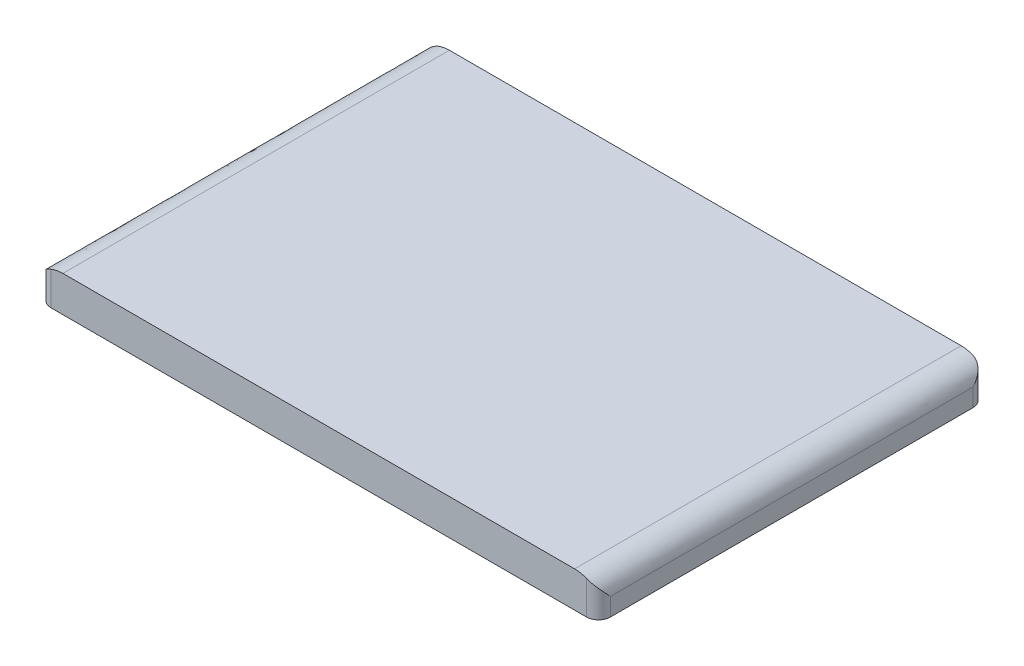
from build123d import *

# Parameters (mm, degrees)
SKETCH1_W           = 93.8
SKETCH1_H           = 32.4
BOSS_EXTRUDE1_DEPTH = 2
SKETCH3_W           = 93.8
SKETCH3_H           = 64.8
SKETCH3_W_2         = 91.4
SKETCH3_H_2         = 62.4
SKETCH3_W_3         = 86.6
SKETCH3_H_3         = 57.6
SKETCH3_W_4         = 83.8
SKETCH3_H_4         = 54.8
BOSS_EXTRUDE2_DEPTH = 4
FILLET6_R           = 2
FILLET8_START       = -66
FILLET8_DEPTH       = 67
FILLET9_R           = 2
FILLET10_R          = 2


with BuildPart() as part:
    # Sketch1 → Boss-Extrude1 (new body)
    with BuildSketch(Plane(origin=(0, 0, 0), x_dir=(1, 0, 0), z_dir=(0, 1, 0))):
        with Locations((46.9, 48.6)):
            Rectangle(SKETCH1_W, SKETCH1_H)
        Polygon((93.8, 32.4), (0, 32.4), (0, 0), (42.9, 0), (50.9, 0), (93.8, 0), align=None)
    extrude(amount=BOSS_EXTRUDE1_DEPTH)

    # Sketch3 → Boss-Extrude2 (add)
    # profile 1 of 2: a face of its own
    with BuildSketch(Plane.XZ):
        with Locations((46.9, -32.4)):
            Rectangle(SKETCH3_W, SKETCH3_H)
        with Locations((46.9, -32.4)):
            Rectangle(SKETCH3_W_2, SKETCH3_H_2, mode=Mode.SUBTRACT)
    # profile 2 of 2: a face of its own
    with BuildSketch(Plane.XZ):
        with Locations((46.9, -32.4)):
            Rectangle(SKETCH3_W_3, SKETCH3_H_3)
        with Locations((46.9, -32.4)):
            Rectangle(SKETCH3_W_4, SKETCH3_H_4, mode=Mode.SUBTRACT)
    extrude(amount=BOSS_EXTRUDE2_DEPTH)

    # Fillet6
    fillet6_edges = [part.edges().sort_by_distance(p)[0] for p in [
        (0, -1, -64.8),
        (93.8, -1, -64.8),
        (93.8, -1, 0),
        (0, -1, 0),
    ]]
    fillet(fillet6_edges, radius=FILLET6_R)

    # Fillet8: read off the stored shape, not the designer's step
    # Fillet8 outline → Fillet8 (cut)
    with BuildSketch(Plane.XY.offset(FILLET8_START)):
        with BuildLine():
            add(Edge.make_bspline(
                [(0, -1), (0, 2), (4, 2)],
                knots=[0, 0, 0, 1, 1, 1], degree=2, weights=[1, 0.707106781, 1]))
            Line((4, 2), (0, 2))
            Line((0, 2), (0, -1))
        make_face()
        with BuildLine():
            add(Edge.make_bspline(
                [(93.8, -1), (93.8, 2), (89.8, 2)],
                knots=[0, 0, 0, 1, 1, 1], degree=2, weights=[1, 0.707106781, 1]))
            Line((93.8, -1), (93.8, 2))
            Line((93.8, 2), (89.8, 2))
        make_face()
    extrude(amount=FILLET8_DEPTH, mode=Mode.SUBTRACT)

    # Fillet9
    fillet9_edges = [part.edges().sort_by_distance(p)[0] for p in [
        (5, 0, -32.4),
        (46.9, 0, -5),
        (88.8, 0, -32.4),
        (46.9, 0, -59.8),
    ]]
    fillet(fillet9_edges, radius=FILLET9_R)

    # Fillet10
    fillet10_edges = [part.edges().sort_by_distance(p)[0] for p in [
        (92.6, -2, -1.2),
    ]]
    fillet(fillet10_edges, radius=FILLET10_R)


solid = part.part
